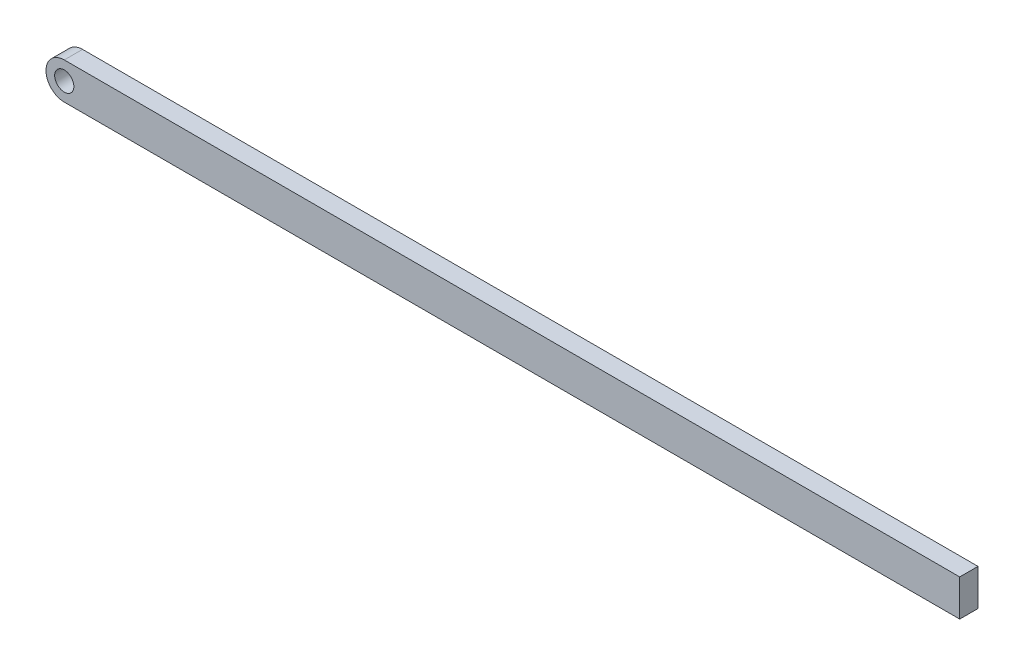
from build123d import *

# Parameters (mm, degrees)
EXTRUDE_1_DEPTH      = 0.5
EXTRUDE_1_DEPTH_BACK = 0.5
SKETCH_1_W           = 100
SKETCH_1_H           = 20
CUT_EXTRUDE_1_DEPTH  = 52
SKETCH_8_R           = 1.5
CUT_EXTRUDE_2_DEPTH  = 52.00000012
SKETCH_9_R           = 1.05
EXTRUDE_2_DEPTH      = 2
OTHER_START          = -0.5
OTHER_1_OUTLINE_W    = 100
OTHER_1_OUTLINE_H    = 20
OTHER_1_OUTLINE_R    = 1.5
OTHER_1_DEPTH        = 1


# Read off the part's stored shape, not the designer's step: Пересечение1
with BuildPart() as part:
    # Эскиз1 → Бобышка-Вытянуть1 (new, two sides: drawn at the far end of the back side and taken through both)
    with BuildSketch(Plane.XY.offset(-EXTRUDE_1_DEPTH_BACK)):
        Rectangle(SKETCH_1_W, SKETCH_1_H)
    extrude(amount=EXTRUDE_1_DEPTH + EXTRUDE_1_DEPTH_BACK)

    # Эскиз7 → Вырез-Вытянуть1 (cut, through all)
    with BuildSketch(Plane.XY.offset(0.5)):
        with BuildLine():
            ThreePointArc((37.261495637, 5.33423095), (37.952030231, 4.100066466), (39.186194715, 4.79060106))
            add(Edge.make_bspline(
                [(39.186194715, 4.79060106), (39.206075717, 4.860988923), (39.262496645, 4.988405972), (39.480772307, 5.263607744), (39.972116976, 5.552949613), (40.89012751, 5.611168859), (42.346211172, 5.064723366), (44.026902125, 2.933159087), (43.815557835, -1.408653234), (40.817030581, -4.80884968), (37.021062322, -6.164885186), (33.732157303, -6.253240822), (30.314099065, -5.243442536), (27.144697082, -3.082909818), (25.035720973, -0.378766084), (23.85308145, 2.208270108), (23.449186454, 3.64108751), (23.305322842, 4.359662985)],
                knots=[0, 0, 0, 0, 0.03125, 0.0625, 0.125, 0.1875, 0.25, 0.375, 0.5, 0.625, 0.6875, 0.75, 0.8125, 0.875, 0.9375, 0.96875, 1, 1, 1, 1], degree=3))
            ThreePointArc((23.305322842, 4.359662985), (22.128470162, 5.143893671), (21.344239476, 3.96704099))
            add(Edge.make_bspline(
                [(37.261495637, 5.33423095), (37.539855307, 6.319751815), (39.275153501, 7.946538331), (43.246471825, 7.317604488), (46.129826318, 3.464099405), (45.771597181, -2.30217859), (41.988507816, -6.528062966), (37.380831362, -8.166298308), (33.454677533, -8.267248255), (29.431863805, -7.074452826), (25.746418814, -4.55740521), (23.320064013, -1.441995451), (21.967408891, 1.518598896), (21.5081203, 3.148482776), (21.344239476, 3.96704099)],
                knots=[0, 0, 0, 0, 0.125, 0.25, 0.375, 0.5, 0.625, 0.6875, 0.75, 0.8125, 0.875, 0.9375, 0.96875, 1, 1, 1, 1], degree=3))
        make_face()
    extrude(amount=-CUT_EXTRUDE_1_DEPTH, mode=Mode.SUBTRACT)

    # Эскиз8 → Вырез-Вытянуть2 (cut, through all)
    with BuildSketch(Plane(origin=(0, 0, -0.5), x_dir=(-1, 0, 0), z_dir=(0, 0, -1))):
        with Locations((-40.392058098, 0)):
            Circle(SKETCH_8_R)
    cut_extrude_2 = extrude(amount=-CUT_EXTRUDE_2_DEPTH, mode=Mode.SUBTRACT)

    # Зеркальное отражение1: Вырез-Вытянуть2 across plane
    add(cut_extrude_2.mirror(Plane(origin=(0, 0, 0), x_dir=(0, 0, 1), z_dir=(1, 0, 0))), mode=Mode.SUBTRACT)

    # Пересечение1 outline → Пересечение1 (cut)
    with BuildSketch(Plane.XY.offset(OTHER_START)):
        Rectangle(OTHER_1_OUTLINE_W, OTHER_1_OUTLINE_H)
        with BuildLine():
            add(Edge.make_bspline(
                [(21.344239476, 3.96704099), (21.5081203, 3.148482776), (21.967408891, 1.518598896), (23.320064013, -1.441995451), (25.746418814, -4.55740521), (29.431863805, -7.074452826), (33.454677533, -8.267248255), (37.380831362, -8.166298308), (41.988507816, -6.528062966), (45.771597181, -2.30217859), (46.129826318, 3.464099405), (43.246471825, 7.317604488), (39.275153501, 7.946538331), (37.539855307, 6.319751815), (37.261495637, 5.33423095)],
                knots=[0, 0, 0, 0, 0.03125, 0.0625, 0.125, 0.1875, 0.25, 0.3125, 0.375, 0.5, 0.625, 0.75, 0.875, 1, 1, 1, 1], degree=3))
            ThreePointArc((21.344239476, 3.96704099), (22.128470161, 5.143893671), (23.305322842, 4.359662985))
            add(Edge.make_bspline(
                [(39.186194715, 4.79060106), (39.206075717, 4.860988923), (39.262496645, 4.988405972), (39.480772307, 5.263607744), (39.972116976, 5.552949613), (40.89012751, 5.611168859), (42.346211172, 5.064723366), (44.026902125, 2.933159087), (43.815557835, -1.408653234), (40.817030581, -4.80884968), (37.021062322, -6.164885186), (33.732157303, -6.253240822), (30.314099065, -5.243442536), (27.144697082, -3.082909818), (25.035720973, -0.378766084), (23.85308145, 2.208270108), (23.449186454, 3.64108751), (23.305322842, 4.359662985)],
                knots=[0, 0, 0, 0, 0.03125, 0.0625, 0.125, 0.1875, 0.25, 0.375, 0.5, 0.625, 0.6875, 0.75, 0.8125, 0.875, 0.9375, 0.96875, 1, 1, 1, 1], degree=3))
            ThreePointArc((39.186194715, 4.79060106), (37.952030231, 4.100066466), (37.261495637, 5.33423095))
        make_face(mode=Mode.SUBTRACT)
        with Locations((-40.392058098, 0)):
            Circle(OTHER_1_OUTLINE_R, mode=Mode.SUBTRACT)
        with Locations((40.392058098, 0)):
            Circle(OTHER_1_OUTLINE_R, mode=Mode.SUBTRACT)
    extrude(amount=OTHER_1_DEPTH, mode=Mode.SUBTRACT)


with BuildPart() as body_2:
    # Эскиз9 → Бобышка-Вытянуть2 (new body)
    with BuildSketch(Plane(origin=(0, 0, -0.5), x_dir=(-1, 0, 0), z_dir=(0, 0, -1))):
        with BuildLine():
            Line((-38.223845176, 7.062416005), (-136.223845176, 7.062416005))
            Line((-136.223845176, 7.062416005), (-136.223845176, 3.062416005))
            Line((-136.223845176, 3.062416005), (-38.223845176, 3.062416005))
            ThreePointArc((-38.223845176, 3.062416005), (-36.223845176, 5.062416005), (-38.223845176, 7.062416005))
        make_face()
        with Locations((-38.223845176, 5.062416005)):
            Circle(SKETCH_9_R, mode=Mode.SUBTRACT)
    extrude(amount=EXTRUDE_2_DEPTH)


solid = body_2.part
